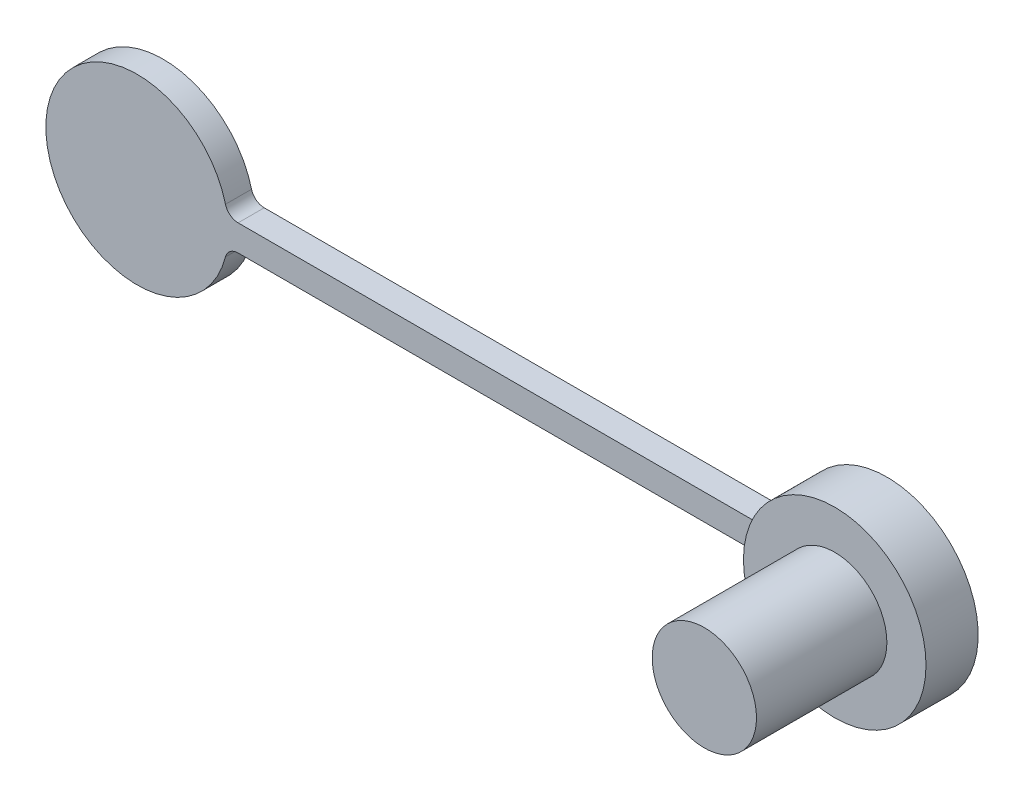
from build123d import *

# Parameters (mm, degrees)
ESBO_O1_R                     = 35
RESSALTO_EXTRUS_O1_DEPTH      = 10
ESBO_O4_W                     = 10
ESBO_O4_H                     = 10
RESSALTO_EXTRUS_O2_DEPTH      = 277.5
FILETE3_R                     = 5
FILETE4_R                     = 5
RESSALTO_EXTRUS_O3_DEPTH      = 10
RESSALTO_EXTRUS_O3_DEPTH_BACK = 10
ESBO_O6_R                     = 35
FILETE5_R                     = 5
FILETE6_R                     = 5
ESBO_O7_R                     = 20
RESSALTO_EXTRUS_O4_DEPTH      = 50


with BuildPart() as part:
    # Esboço1 → Ressalto-extrusão1 (new body)
    with BuildSketch(Plane(origin=(0, 0, 0), x_dir=(0, 1, 0), z_dir=(0, 0, 1))):
        with Locations(Location((0, 0, 0), (0, 0, 270))):
            Circle(ESBO_O1_R)
    extrude(amount=RESSALTO_EXTRUS_O1_DEPTH)

    # Esboço4 → Ressalto-extrusão2 (add)
    with BuildSketch(Plane.YZ):
        with Locations((0, 5)):
            Rectangle(ESBO_O4_W, ESBO_O4_H)
    extrude(amount=RESSALTO_EXTRUS_O2_DEPTH)

    # Filete3
    filete3_edges = [part.edges().sort_by_distance(p)[0] for p in [
        (34.641016151, -5, 5),
    ]]
    fillet(filete3_edges, radius=FILETE3_R)

    # Filete4
    filete4_edges = [part.edges().sort_by_distance(p)[0] for p in [
        (34.641016151, 5, 5),
    ]]
    fillet(filete4_edges, radius=FILETE4_R)

    # Esboço6 → Ressalto-extrusão3 (add, two sides: drawn at the far end of the back side and taken through both)
    with BuildSketch(Plane.XY.offset(10).offset(-RESSALTO_EXTRUS_O3_DEPTH_BACK)):
        with Locations(Location((277.5, 0, 0), (0, 0, 171.786789298))):
            Circle(ESBO_O6_R)
    extrude(amount=RESSALTO_EXTRUS_O3_DEPTH + RESSALTO_EXTRUS_O3_DEPTH_BACK)

    # Filete5
    filete5_edges = [part.edges().sort_by_distance(p)[0] for p in [
        (242.858983849, -5, 5),
    ]]
    fillet(filete5_edges, radius=FILETE5_R)

    # Filete6
    # the kernel refuses this fillet: 5 mm, written as the material it adds along each edge
    with BuildSketch(Plane(origin=(242.858983849, 5, 10), x_dir=(0.1967224418008006, 0.9804592193925918, 0), z_dir=(0, 0, -1))) as filete6_piece_1:
        with BuildLine():
            CenterArc((4.097933971, -4.992530838), FILETE6_R, 93.132150742, 75.522487814)
            Line((-0.804362126, -4.008918629), (0, 0))
            ThreePointArc((0, 0), (1.912369187, -0.052284136), (3.824738373, 0))
        make_face()
    extrude(amount=10)

    # Esboço7 → Ressalto-extrusão4 (add)
    with BuildSketch(Plane.XY.offset(20)):
        with Locations((277.5, 0)):
            Circle(ESBO_O7_R)
    extrude(amount=RESSALTO_EXTRUS_O4_DEPTH)


solid = part.part
